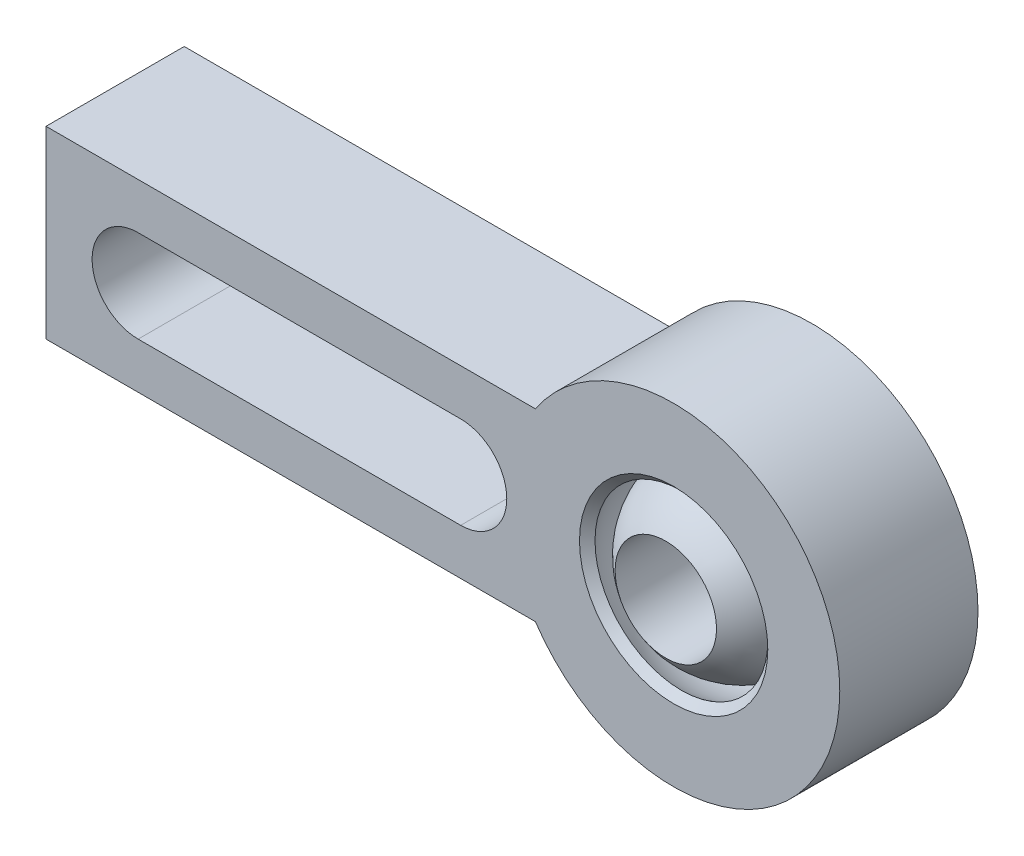
from build123d import *

# Parameters (mm, degrees)
BOSS_EXTRUDE2_DEPTH     = 3.81
CUT_EXTRUDE1_DEPTH      = 29.776153565
CUT_EXTRUDE1_DEPTH_BACK = 29.776153565
CHAMFER2_SIZE           = 0.540332298
CHAMFER2_SIZE_2         = 0.762


with BuildPart() as part:
    # Sketch1 → Boss-Extrude2 (new, symmetric)
    with BuildSketch(Plane.XY):
        with BuildLine():
            Line((-24.578640541, 9.699725393), (-24.578640541, -0.460274607))
            Line((-24.578640541, -0.460274607), (2.401375717, -0.460274607))
            ThreePointArc((2.401375717, -0.460274607), (19.179475957, 4.619725393), (2.401375717, 9.699725393))
            Line((2.401375717, 9.699725393), (-24.578640541, 9.699725393))
        make_face()
        with BuildLine():
            Line((-19.498640541, 7.159725393), (-1.718640541, 7.159725393))
            ThreePointArc((-1.718640541, 7.159725393), (0.821359459, 4.619725393), (-1.718640541, 2.079725393))
            Line((-1.718640541, 2.079725393), (-19.498640541, 2.079725393))
            ThreePointArc((-19.498640541, 2.079725393), (-22.038640541, 4.619725393), (-19.498640541, 7.159725393))
        make_face(mode=Mode.SUBTRACT)
    extrude(amount=BOSS_EXTRUDE2_DEPTH, both=True)

    # Sketch1<11> → Cut-Revolve9 (revolve, cut)
    with BuildSketch(Plane.XY):
        with BuildLine():
            Line((10.021375717, 10.461725393), (10.021375717, -1.222274607))
            ThreePointArc((10.021375717, -1.222274607), (4.179375717, 4.619725393), (10.021375717, 10.461725393))
        make_face()
    revolve(axis=Axis((10.021375717, 10.461725393, 0), (0, -1, 0)), mode=Mode.SUBTRACT)

    # Chamfer2
    # the kernel refuses this chamfer: 0.762, 0.540332298 mm, written as the material it takes off along each edge
    with BuildSketch(Plane(origin=(10.021375717, 4.619725393, -3.81), x_dir=(0, -1, 0), z_dir=(-1, 0, 0))) as chamfer2_piece_1:
        with BuildLine():
            Line((4.428641327 + CHAMFER2_SIZE, 0), (4.919476262, 0.659171964))
            ThreePointArc((4.919476262, 0.659171964), (4.692557062, 0.330219516), (4.428641327, 0))
            Line((4.428641327, 0), (4.428641327 + CHAMFER2_SIZE, 0))
        make_face()
    revolve(axis=Axis((10.021375717, 4.619725393, -3.81), (0, 0, 1)), mode=Mode.SUBTRACT)
    with BuildSketch(Plane(origin=(10.021375717, 4.619725393, 3.81), x_dir=(0, -1, 0), z_dir=(-1, 0, 0))) as chamfer2_piece_2:
        with BuildLine():
            Line((4.428641327 + CHAMFER2_SIZE_2, 0), (4.763150071, -0.427491256))
            ThreePointArc((4.763150071, -0.427491256), (4.60200498, -0.211317719), (4.428641327, 0))
            Line((4.428641327, 0), (4.428641327 + CHAMFER2_SIZE_2, 0))
        make_face()
    revolve(axis=Axis((10.021375717, 4.619725393, 3.81), (0, 0, 1)), mode=Mode.SUBTRACT)


with BuildPart() as body_2:
    # Sketch1<12> → Revolve7 (revolve)
    with BuildSketch(Plane.XY):
        with BuildLine():
            Line((10.021375717, 7.413725393), (10.021375717, 9.699725393))
            ThreePointArc((10.021375717, 9.699725393), (4.941375717, 4.619725393), (10.021375717, -0.460274607))
            Line((10.021375717, -0.460274607), (10.021375717, 1.825725393))
            ThreePointArc((10.021375717, 1.825725393), (7.227375717, 4.619725393), (10.021375717, 7.413725393))
        make_face()
    revolve(axis=Axis((10.021375717, 10.461725393, 0), (0, -1, 0)))

    # Sketch1<13> → Cut-Extrude1 (cut, two sides: drawn at the far end of the back side and taken through both)
    with BuildSketch(Plane.XY.offset(-CUT_EXTRUDE1_DEPTH_BACK)):
        with BuildLine():
            ThreePointArc((12.815375717, 4.619725393), (11.997032064, 6.595381739), (10.021375717, 7.413725393))
            Line((10.021375717, 7.413725393), (10.021375717, 1.825725393))
            ThreePointArc((10.021375717, 1.825725393), (11.997032064, 2.644069046), (12.815375717, 4.619725393))
        make_face()
        with BuildLine():
            Line((10.021375717, 1.825725393), (10.021375717, 7.413725393))
            ThreePointArc((10.021375717, 7.413725393), (7.227375717, 4.619725393), (10.021375717, 1.825725393))
        make_face()
    extrude(amount=CUT_EXTRUDE1_DEPTH + CUT_EXTRUDE1_DEPTH_BACK, mode=Mode.SUBTRACT)


solid = Compound([part.part, body_2.part])
